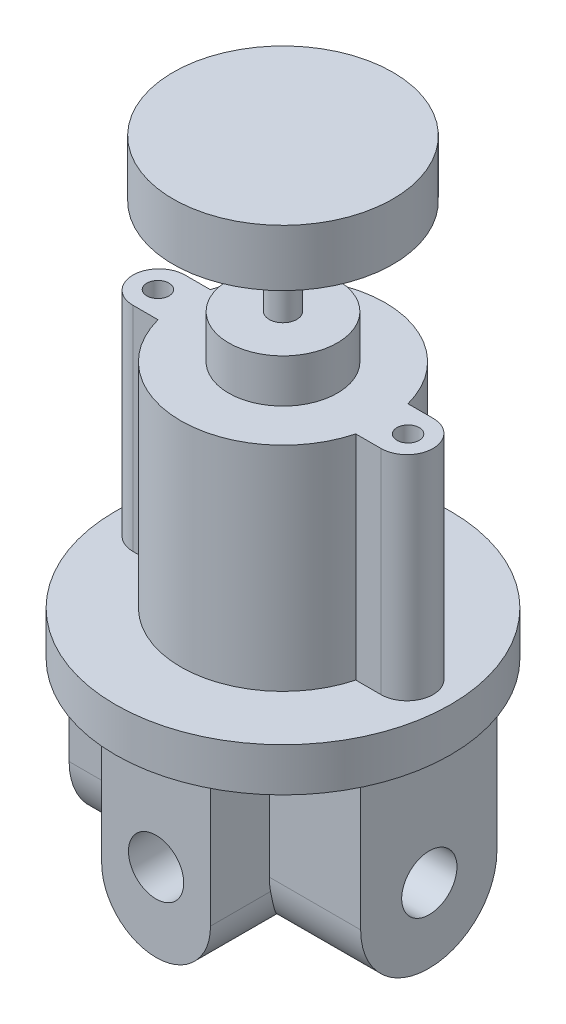
from build123d import *

# Parameters (mm, degrees)
BOSS_EXTRUDE1_DEPTH        = 49
F_1_4_20_TAPPED_HOLE1_D    = 5.1054
SKETCH4_R                  = 38.5
BOSS_EXTRUDE2_DEPTH        = 10
BOSS_EXTRUDE3_DEPTH        = 45
FILLET1_R                  = 12.5
FILLET2_R                  = 15.5
F_1_2_0_5_DIAMETER_HOLE1_D = 12.7
F_1_2_0_5_DIAMETER_HOLE2_D = 12.7
SKETCH10_R                 = 12.5
BOSS_EXTRUDE4_DEPTH        = 10
SKETCH11_R                 = 3.175
BOSS_EXTRUDE5_DEPTH        = 22
SKETCH12_R                 = 25.25
BOSS_EXTRUDE6_DEPTH        = 13


with BuildPart() as part:
    # Sketch1 → Boss-Extrude1 (new body)
    with BuildSketch(Plane(origin=(0, 0, 0), x_dir=(1, 0, 0), z_dir=(0, 1, 0))):
        with BuildLine():
            Line((-28.5, 6), (-22.721135535, 6))
            ThreePointArc((-22.721135535, 6), (0, 23.5), (22.721135535, 6))
            Line((22.721135535, 6), (28.5, 6))
            ThreePointArc((28.5, 6), (34.5, 0), (28.5, -6))
            Line((28.5, -6), (22.721135535, -6))
            ThreePointArc((22.721135535, -6), (0, -23.5), (-22.721135535, -6))
            Line((-22.721135535, -6), (-28.5, -6))
            ThreePointArc((-28.5, -6), (-34.5, 0), (-28.5, 6))
        make_face()
    extrude(amount=-BOSS_EXTRUDE1_DEPTH)

    # 1/4-20 Tapped Hole1 (through all)
    with Locations(Plane(origin=(0, 0, 0), x_dir=(1, 0, 0), z_dir=(0, 1, 0))):
        with Locations((-28.75, 0), (28.75, 0)):
            Hole(F_1_4_20_TAPPED_HOLE1_D / 2)

    # Sketch4 → Boss-Extrude2 (add)
    with BuildSketch(Plane.XZ.offset(49)):
        with Locations(Location((0, 0, 0), (0, 0, 270))):
            Circle(SKETCH4_R)
    extrude(amount=BOSS_EXTRUDE2_DEPTH)

    # Sketch5 → Boss-Extrude3 (add)
    with BuildSketch(Plane.XZ.offset(59)):
        Polygon((12.5, 15.65), (33.5, 15.65), (33.5, -15.65), (12.5, -15.65), (12.5, -29.165), (-12.5, -29.165), (-12.5, -15.65), (-33.5, -15.65), (-33.5, 15.65), (-12.5, 15.65), (-12.5, 29.165), (12.5, 29.165), align=None)
    extrude(amount=BOSS_EXTRUDE3_DEPTH)

    # Fillet1
    fillet1_edges = [part.edges().sort_by_distance(p)[0] for p in [
        (12.5, -104, 22.4075),
        (-12.5, -104, 22.4075),
        (-12.5, -104, -22.4075),
        (12.5, -104, -22.4075),
    ]]
    fillet(fillet1_edges, radius=FILLET1_R - 0.0001)  # a hair under: the kernel refuses the full size

    # Fillet2
    fillet2_edges = [part.edges().sort_by_distance(p)[0] for p in [
        (-16.75005, -104, 15.65),
        (-16.75005, -104, -15.65),
        (16.75005, -104, 15.65),
        (16.75005, -104, -15.65),
    ]]
    fillet(fillet2_edges, radius=FILLET2_R)

    # 1/2 (0.5) Diameter Hole1 (through all)
    with Locations(Plane(origin=(0, 0, -29.165), x_dir=(-1, 0, 0), z_dir=(0, 0, -1))):
        with Locations((0, -86)):
            Hole(F_1_2_0_5_DIAMETER_HOLE1_D / 2)

    # 1/2 (0.5) Diameter Hole2 (through all)
    with Locations(Plane(origin=(33.5, 0, 0), x_dir=(0, 0, -1), z_dir=(1, 0, 0))):
        with Locations((0.125480769, -87)):
            Hole(F_1_2_0_5_DIAMETER_HOLE2_D / 2)

    # Sketch10 → Boss-Extrude4 (add)
    with BuildSketch(Plane(origin=(0, 0, 0), x_dir=(1, 0, 0), z_dir=(0, 1, 0))):
        with Locations(Location((0, 0, 0), (0, 0, 270))):
            Circle(SKETCH10_R)
    extrude(amount=BOSS_EXTRUDE4_DEPTH)

    # Sketch11 → Boss-Extrude5 (add)
    with BuildSketch(Plane(origin=(0, 10, 0), x_dir=(1, 0, 0), z_dir=(0, 1, 0))):
        with Locations(Location((0, 0, 0), (0, 0, 270))):
            Circle(SKETCH11_R)
    extrude(amount=BOSS_EXTRUDE5_DEPTH)

    # Sketch12 → Boss-Extrude6 (add)
    with BuildSketch(Plane(origin=(0, 32, 0), x_dir=(1, 0, 0), z_dir=(0, 1, 0))):
        with Locations(Location((0, 0, 0), (0, 0, 90))):
            Circle(SKETCH12_R)
    extrude(amount=BOSS_EXTRUDE6_DEPTH)


solid = part.part
